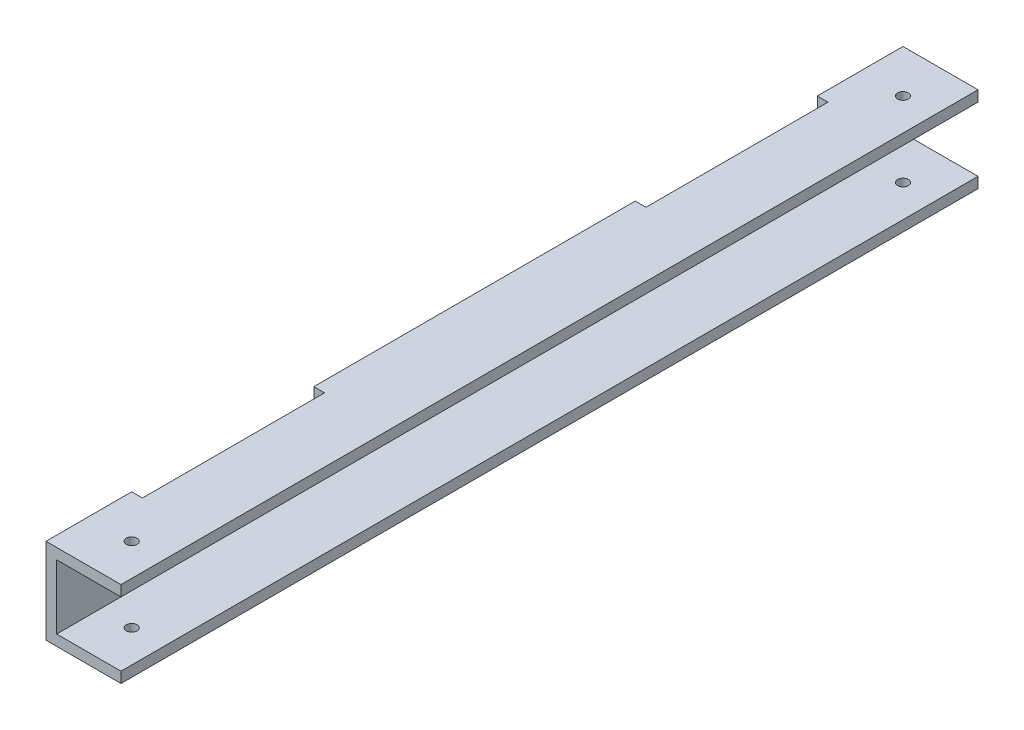
from build123d import *

# Parameters (mm, degrees)
EXTRUDE_1_DEPTH     = 254
SKETCH_2_R          = 1.5875
SKETCH_2_W          = 3.175
SKETCH_2_H          = 53.975
CUT_EXTRUDE_1_DEPTH = 25.4
SKETCH_3_R          = 1.5875
CUT_EXTRUDE_2_DEPTH = 5.08


with BuildPart() as part:
    # 스케치1 → 보스-돌출1 (new body)
    with BuildSketch(Plane.XY):
        Polygon((11.1125, 9.525), (11.1125, 12.7), (-11.1125, 12.7), (-11.1125, -12.7), (11.1125, -12.7), (11.1125, -9.525), (-7.9375, -9.525), (-7.9375, 9.525), align=None)
    extrude(amount=EXTRUDE_1_DEPTH)

    # 스케치2 → 컷-돌출1 (cut)
    with BuildSketch(Plane(origin=(0, 12.7, 0), x_dir=(1, 0, 0), z_dir=(0, 1, 0))):
        with Locations((1.5875, -241.3)):
            Circle(SKETCH_2_R)
        with Locations((1.5875, -12.7)):
            Circle(SKETCH_2_R)
        with Locations((-9.525, -52.3875)):
            Rectangle(SKETCH_2_W, SKETCH_2_H)
        with Locations((-9.525, -201.6125)):
            Rectangle(SKETCH_2_W, SKETCH_2_H)
    extrude(amount=-CUT_EXTRUDE_1_DEPTH, mode=Mode.SUBTRACT)

    # 스케치3 → 컷-돌출2 (cut)
    with BuildSketch(Plane.ZY.offset(11.1125)):
        with Locations((12.7, 0)):
            Circle(SKETCH_3_R)
        with Locations((92.075, 0)):
            Circle(SKETCH_3_R)
        with Locations((241.3, 0)):
            Circle(SKETCH_3_R)
        with Locations((161.925, 0)):
            Circle(SKETCH_3_R)
    extrude(amount=-CUT_EXTRUDE_2_DEPTH, mode=Mode.SUBTRACT)


solid = part.part
